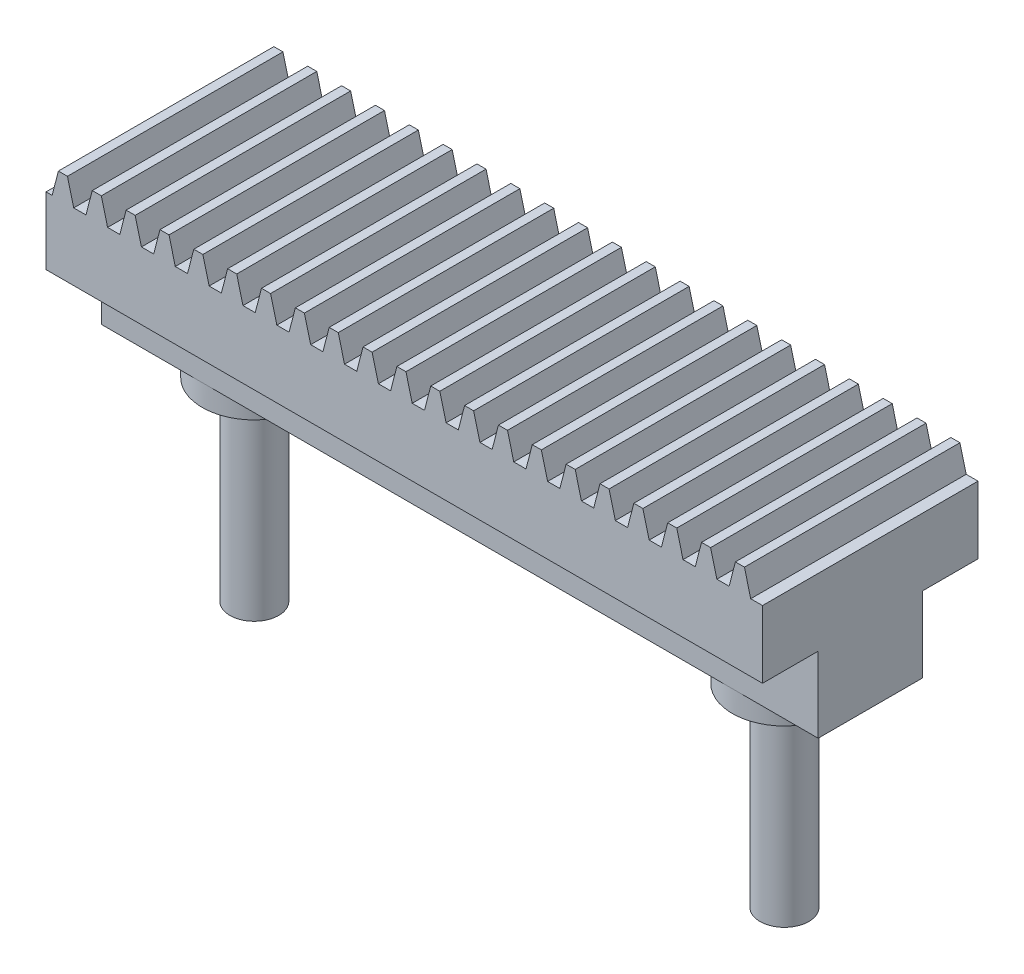
from build123d import *

# Parameters (mm, degrees)
BLANKSKE_W                 = 100
BLANKSKE_H                 = 12.75
BLANK_DEPTH                = 20
TOOTHCUTSIM_DEPTH          = 103.77432802
TEETHCUTS_COUNT            = 23
TEETHCUTS_PITCH            = 4.712388975
SALIENTE_EXTRUIR1_DEPTH    = 10
CORTAR_EXTRUIR1_DEPTH      = 103.77432802
CORTAR_EXTRUIR1_DEPTH_BACK = 0.25
CROQUIS12_W                = 30
CROQUIS12_H                = 10.100558753
CROQUIS13_W                = 99.75
CROQUIS13_H                = 14.5
SALIENTE_EXTRUIR6_DEPTH    = 10.5
CROQUIS14_R                = 7.25
CROQUIS14_R_2              = 3.4
SALIENTE_EXTRUIR7_DEPTH    = 3
CROQUIS15_R                = 3.4
SALIENTE_EXTRUIR8_DEPTH    = 30
CORTAR_EXTRUIR2_DEPTH      = 110.933502628
CORTAR_EXTRUIR2_DEPTH_BACK = 110.933502628
CROQUIS16_W                = 6.2
CROQUIS16_H                = 3.2


with BuildPart() as part:
    # BlankSke → Blank (new body)
    with BuildSketch(Plane.XY):
        with Locations((50, 6.375)):
            Rectangle(BLANKSKE_W, BLANKSKE_H)
    extrude(amount=-BLANK_DEPTH)

    # TooCutSkeSim → ToothCutSim (cut, through all)
    with BuildSketch(Plane.XY):
        Polygon((0.852189273, 9.375), (-0.852189273, 9.375), (-1.731592507, 12.7754), (1.731592507, 12.7754), align=None)
    toothcutsim = extrude(amount=-TOOTHCUTSIM_DEPTH, mode=Mode.SUBTRACT)

    # TeethCuts: ToothCutSim ×23
    with Locations(*[(i * TEETHCUTS_PITCH, 0, 0) for i in range(1, TEETHCUTS_COUNT)]):
        add(toothcutsim, mode=Mode.SUBTRACT)

    # Croquis1 → Saliente-Extruir1 (add)
    with BuildSketch(Plane.XY):
        Polygon((99.812357748, 9.375), (98.107979202, 9.375), (97.235144855, 12.75), (95.97280312, 12.75), (95.099968773, 9.375), (93.395590227, 9.375), (92.52275588, 12.75), (91.260414145, 12.75), (90.387579798, 9.375), (88.683201252, 9.375), (87.810366905, 12.75), (86.54802517, 12.75), (85.675190823, 9.375), (83.970812277, 9.375), (83.09797793, 12.75), (81.835636195, 12.75), (80.962801848, 9.375), (79.258423302, 9.375), (78.385588955, 12.75), (77.12324722, 12.75), (76.250412873, 9.375), (74.546034327, 9.375), (73.67319998, 12.75), (72.410858245, 12.75), (71.538023898, 9.375), (69.833645352, 9.375), (68.960811005, 12.75), (67.69846927, 12.75), (66.825634923, 9.375), (65.121256377, 9.375), (64.24842203, 12.75), (62.986080295, 12.75), (62.113245948, 9.375), (60.408867402, 9.375), (59.536033055, 12.75), (58.27369132, 12.75), (57.400856973, 9.375), (55.696478427, 9.375), (54.82364408, 12.75), (53.561302345, 12.75), (52.688467998, 9.375), (50.984089452, 9.375), (50.111255105, 12.75), (48.84891337, 12.75), (47.976079023, 9.375), (46.271700477, 9.375), (45.39886613, 12.75), (44.136524395, 12.75), (43.263690048, 9.375), (41.559311502, 9.375), (40.686477155, 12.75), (39.42413542, 12.75), (38.551301073, 9.375), (36.846922527, 9.375), (35.97408818, 12.75), (34.711746445, 12.75), (33.838912098, 9.375), (32.134533552, 9.375), (31.261699205, 12.75), (29.99935747, 12.75), (29.126523123, 9.375), (27.422144577, 9.375), (26.54931023, 12.75), (25.286968495, 12.75), (24.414134148, 9.375), (22.709755602, 9.375), (21.836921255, 12.75), (20.57457952, 12.75), (19.701745173, 9.375), (17.997366627, 9.375), (17.12453228, 12.75), (15.862190545, 12.75), (14.989356198, 9.375), (13.284977652, 9.375), (12.412143305, 12.75), (11.14980157, 12.75), (10.276967223, 9.375), (8.572588677, 9.375), (7.69975433, 12.75), (6.437412595, 12.75), (5.564578248, 9.375), (3.860199702, 9.375), (2.987365355, 12.75), (1.72502362, 12.75), (0.852189273, 9.375), (0, 9.375), (0, 0), (100, 0), (100, 10.100558753), align=None)
    extrude(amount=SALIENTE_EXTRUIR1_DEPTH)

    # Croquis12 → Cortar-Extruir1 (cut, two sides: drawn at the far end of the back side and taken through both)
    with BuildSketch(Plane(origin=(100, 0, 0), x_dir=(0, 0, -1), z_dir=(1, 0, 0)).offset(-CORTAR_EXTRUIR1_DEPTH_BACK)):
        with Locations((5, 5.050279377)):
            Rectangle(CROQUIS12_W, CROQUIS12_H)
    extrude(amount=CORTAR_EXTRUIR1_DEPTH + CORTAR_EXTRUIR1_DEPTH_BACK, mode=Mode.SUBTRACT)

    # Croquis13 → Saliente-Extruir6 (add)
    with BuildSketch(Plane.XZ):
        with Locations((49.875, -5)):
            Rectangle(CROQUIS13_W, CROQUIS13_H)
    extrude(amount=SALIENTE_EXTRUIR6_DEPTH)

    # Croquis14 → Saliente-Extruir7 (add)
    # profile 1 of 2: a face of its own
    with BuildSketch(Plane.XZ.offset(10.5)):
        with Locations((14, -5)):
            Circle(CROQUIS14_R)
        with Locations((14, -5)):
            Circle(CROQUIS14_R_2, mode=Mode.SUBTRACT)
    # profile 2 of 2: a face of its own
    with BuildSketch(Plane.XZ.offset(10.5)):
        with Locations((87.8, -5)):
            Circle(CROQUIS14_R)
        with Locations((87.8, -5)):
            Circle(CROQUIS14_R_2, mode=Mode.SUBTRACT)
    extrude(amount=SALIENTE_EXTRUIR7_DEPTH)

    # Croquis15 → Saliente-Extruir8 (add)
    with BuildSketch(Plane.XZ.offset(10.5)):
        with Locations((87.8, -5)):
            Circle(CROQUIS15_R)
        with Locations((14, -5)):
            Circle(CROQUIS15_R)
    extrude(amount=SALIENTE_EXTRUIR8_DEPTH)

    # Croquis16 → Cortar-Extruir2 (cut, two sides: drawn at the far end of the back side and taken through both)
    with BuildSketch(Plane.XY.offset(2.25).offset(-CORTAR_EXTRUIR2_DEPTH_BACK)):
        with Locations((43.1, -3)):
            Rectangle(CROQUIS16_W, CROQUIS16_H)
        with Locations((31.1, -3)):
            Rectangle(CROQUIS16_W, CROQUIS16_H)
        with Locations((55.1, -3)):
            Rectangle(CROQUIS16_W, CROQUIS16_H)
        with Locations((67.1, -3)):
            Rectangle(CROQUIS16_W, CROQUIS16_H)
        with Locations((79.1, -3)):
            Rectangle(CROQUIS16_W, CROQUIS16_H)
        with Locations((91.1, -3)):
            Rectangle(CROQUIS16_W, CROQUIS16_H)
    extrude(amount=CORTAR_EXTRUIR2_DEPTH + CORTAR_EXTRUIR2_DEPTH_BACK, mode=Mode.SUBTRACT)


solid = part.part
